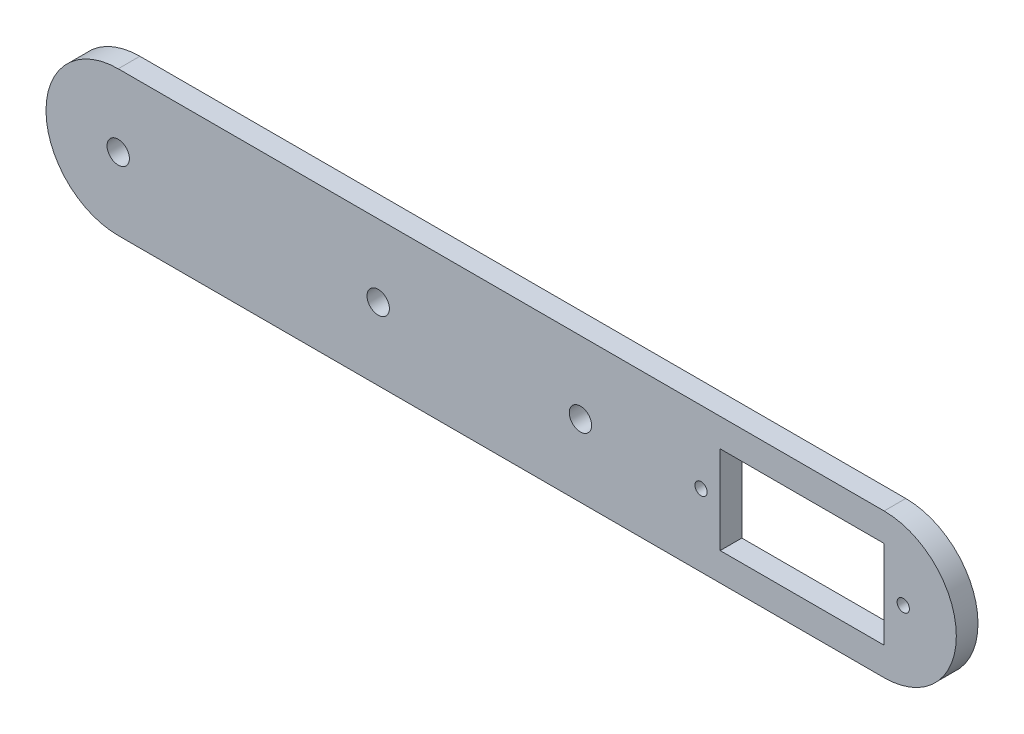
from build123d import *

# Parameters (mm, degrees)
BOSS_EXTRUDE1_DEPTH = 3
SKETCH3_R           = 1.55
CUT_EXTRUDE2_DEPTH  = 3
SKETCH4_R           = 1.55
CUT_EXTRUDE4_DEPTH  = 3
SKETCH5_R           = 1.55
CUT_EXTRUDE6_DEPTH  = 3
SKETCH6_W           = 22.7
SKETCH6_H           = 12.2
CUT_EXTRUDE7_DEPTH  = 3
SKETCH7_R           = 0.85
CUT_EXTRUDE8_DEPTH  = 3


with BuildPart() as part:
    # Sketch1 → Boss-Extrude1 (new body)
    with BuildSketch(Plane.XY):
        with BuildLine():
            Line((-58.058617241, 24.191090517), (47.991382759, 24.191090517))
            ThreePointArc((47.991382759, 24.191090517), (57.991382759, 14.191090517), (47.991382759, 4.191090517))
            Line((47.991382759, 4.191090517), (-58.058617241, 4.191090517))
            ThreePointArc((-58.058617241, 4.191090517), (-68.058617241, 14.191090517), (-58.058617241, 24.191090517))
        make_face()
    extrude(amount=BOSS_EXTRUDE1_DEPTH)

    # Sketch3 → Cut-Extrude2 (cut)
    with BuildSketch(Plane.XY.offset(3)):
        with Locations((-58.058617241, 14.191090517)):
            Circle(SKETCH3_R)
    extrude(amount=-CUT_EXTRUDE2_DEPTH, mode=Mode.SUBTRACT)

    # Sketch4 → Cut-Extrude4 (cut)
    with BuildSketch(Plane(origin=(9.979459273, 1.433252018, 3), x_dir=(1, 0, 0), z_dir=(0, 0, 1))):
        with Locations((-4.038076514, 12.757838499)):
            Circle(SKETCH4_R)
    extrude(amount=-CUT_EXTRUDE4_DEPTH, mode=Mode.SUBTRACT)

    # Sketch5 → Cut-Extrude6 (cut)
    with BuildSketch(Plane(origin=(-9.979459273, 1.433252018, 0), x_dir=(-1, 0, 0), z_dir=(0, 0, -1))):
        with Locations((12.079157968, 12.757838499)):
            Circle(SKETCH5_R)
    extrude(amount=-CUT_EXTRUDE6_DEPTH, mode=Mode.SUBTRACT)

    # Sketch6 → Cut-Extrude7 (cut)
    with BuildSketch(Plane.XY.offset(3)):
        with Locations((36.641382759, 14.191090517)):
            Rectangle(SKETCH6_W, SKETCH6_H)
    extrude(amount=-CUT_EXTRUDE7_DEPTH, mode=Mode.SUBTRACT)

    # Sketch7 → Cut-Extrude8 (cut)
    with BuildSketch(Plane(origin=(0, 0, 0), x_dir=(-1, 0, 0), z_dir=(0, 0, -1))):
        with Locations((-22.641382759, 14.191090517)):
            Circle(SKETCH7_R)
        with Locations((-50.641382759, 14.191090517)):
            Circle(SKETCH7_R)
    extrude(amount=-CUT_EXTRUDE8_DEPTH, mode=Mode.SUBTRACT)


solid = part.part
